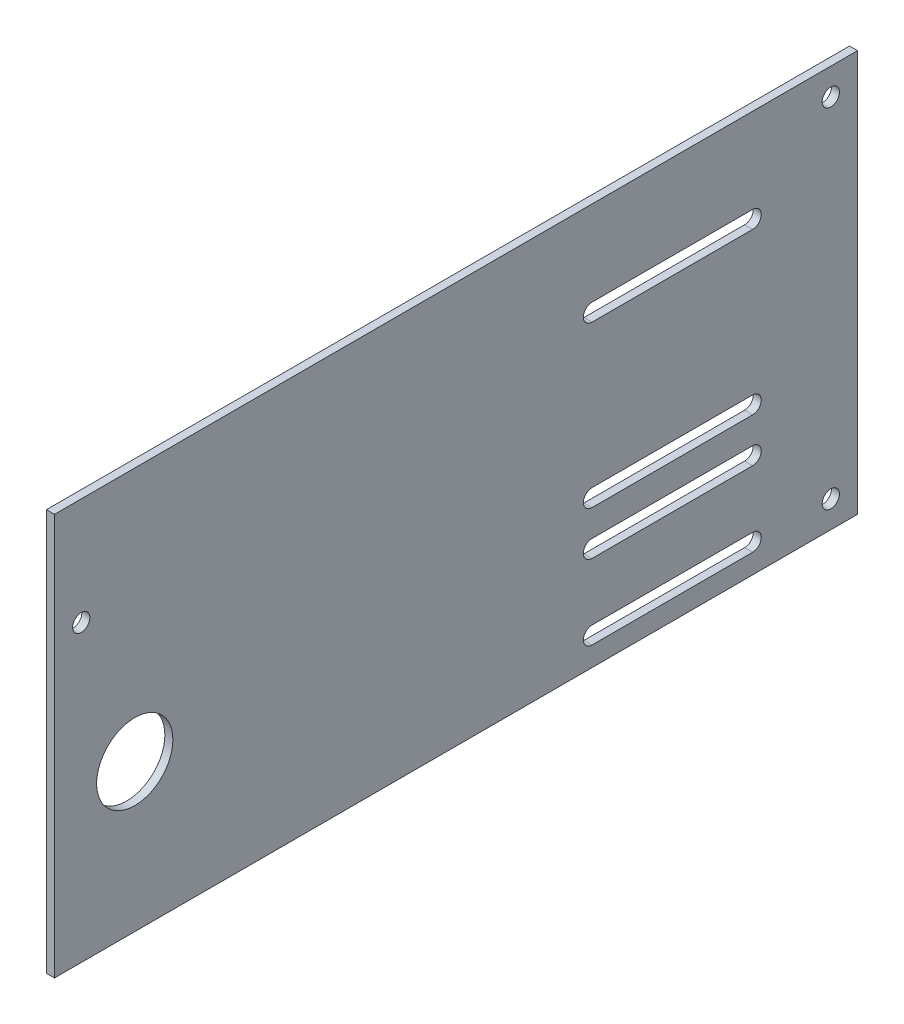
from build123d import *

# Parameters (mm, degrees)
SKETCH1_W           = 300
SKETCH1_H           = 150
SKETCH1_R           = 14.235
BOSS_EXTRUDE1_DEPTH = 3
CUT_EXTRUDE1_REACH  = 337.424
SKETCH2_R           = 3.225


with BuildPart() as part:
    # Sketch1 → Boss-Extrude1 (new body)
    with BuildSketch(Plane(origin=(0, 0, 0), x_dir=(0, 0, -1), z_dir=(1, 0, 0))):
        with Locations((150, 75)):
            Rectangle(SKETCH1_W, SKETCH1_H)
        with Locations((30, 55)):
            Circle(SKETCH1_R, mode=Mode.SUBTRACT)
    extrude(amount=BOSS_EXTRUDE1_DEPTH)

    # Sketch2 → Cut-Extrude1 (cut, up to next)
    with BuildSketch(Plane.ZY, mode=Mode.PRIVATE) as cut_extrude1_sk1:
        with Locations((-290, 140)):
            Circle(SKETCH2_R)
    cut_extrude1_tool1 = extrude(cut_extrude1_sk1.sketch, amount=-CUT_EXTRUDE1_REACH, mode=Mode.PRIVATE) & part.part
    # Sketch2 → Cut-Extrude1 (cut, up to next)
    with BuildSketch(Plane.ZY, mode=Mode.PRIVATE) as cut_extrude1_sk2:
        with Locations((-10, 110)):
            Circle(SKETCH2_R)
    cut_extrude1_tool2 = extrude(cut_extrude1_sk2.sketch, amount=-CUT_EXTRUDE1_REACH, mode=Mode.PRIVATE) & part.part
    # Sketch2 → Cut-Extrude1 (cut, up to next)
    with BuildSketch(Plane.ZY, mode=Mode.PRIVATE) as cut_extrude1_sk3:
        with Locations((-290, 10)):
            Circle(SKETCH2_R)
    cut_extrude1_tool3 = extrude(cut_extrude1_sk3.sketch, amount=-CUT_EXTRUDE1_REACH, mode=Mode.PRIVATE) & part.part
    # Sketch2 → Cut-Extrude1 (cut, up to next)
    with BuildSketch(Plane.ZY, mode=Mode.PRIVATE) as cut_extrude1_sk4:
        with BuildLine():
            Line((-260.8, 58.225), (-200.8, 58.225))
            ThreePointArc((-200.8, 58.225), (-197.575, 55), (-200.8, 51.775))
            Line((-200.8, 51.775), (-260.8, 51.775))
            ThreePointArc((-260.8, 51.775), (-264.025, 55), (-260.8, 58.225))
        make_face()
    cut_extrude1_tool4 = extrude(cut_extrude1_sk4.sketch, amount=-CUT_EXTRUDE1_REACH, mode=Mode.PRIVATE) & part.part
    # Sketch2 → Cut-Extrude1 (cut, up to next)
    with BuildSketch(Plane.ZY, mode=Mode.PRIVATE) as cut_extrude1_sk5:
        with BuildLine():
            Line((-200.8, 111.77), (-260.8, 111.77))
            ThreePointArc((-260.8, 111.77), (-264.03, 115), (-260.8, 118.23))
            Line((-260.8, 118.23), (-200.8, 118.23))
            ThreePointArc((-200.8, 118.23), (-197.57, 115), (-200.8, 111.77))
        make_face()
    cut_extrude1_tool5 = extrude(cut_extrude1_sk5.sketch, amount=-CUT_EXTRUDE1_REACH, mode=Mode.PRIVATE) & part.part
    # Sketch2 → Cut-Extrude1 (cut, up to next)
    with BuildSketch(Plane.ZY, mode=Mode.PRIVATE) as cut_extrude1_sk6:
        with BuildLine():
            Line((-260.8, 41.775), (-200.8, 41.775))
            ThreePointArc((-200.8, 41.775), (-197.575, 38.55), (-200.8, 35.325))
            Line((-200.8, 35.325), (-260.8, 35.325))
            ThreePointArc((-260.8, 35.325), (-264.025, 38.55), (-260.8, 41.775))
        make_face()
    cut_extrude1_tool6 = extrude(cut_extrude1_sk6.sketch, amount=-CUT_EXTRUDE1_REACH, mode=Mode.PRIVATE) & part.part
    # Sketch2 → Cut-Extrude1 (cut, up to next)
    with BuildSketch(Plane.ZY, mode=Mode.PRIVATE) as cut_extrude1_sk7:
        with BuildLine():
            Line((-260.8, 13.775), (-200.8, 13.775))
            ThreePointArc((-200.8, 13.775), (-197.575, 10.55), (-200.8, 7.325))
            Line((-200.8, 7.325), (-260.8, 7.325))
            ThreePointArc((-260.8, 7.325), (-264.025, 10.55), (-260.8, 13.775))
        make_face()
    cut_extrude1_tool7 = extrude(cut_extrude1_sk7.sketch, amount=-CUT_EXTRUDE1_REACH, mode=Mode.PRIVATE) & part.part
    add(cut_extrude1_tool1.solids().sort_by_distance((0, 140, -290))[0], mode=Mode.SUBTRACT)
    add(cut_extrude1_tool2.solids().sort_by_distance((0, 110, -10))[0], mode=Mode.SUBTRACT)
    add(cut_extrude1_tool3.solids().sort_by_distance((0, 10, -290))[0], mode=Mode.SUBTRACT)
    add(cut_extrude1_tool4.solids().sort_by_distance((0, 55, -230.8))[0], mode=Mode.SUBTRACT)
    add(cut_extrude1_tool5.solids().sort_by_distance((0, 115, -230.8))[0], mode=Mode.SUBTRACT)
    add(cut_extrude1_tool6.solids().sort_by_distance((0, 38.55, -230.8))[0], mode=Mode.SUBTRACT)
    add(cut_extrude1_tool7.solids().sort_by_distance((0, 10.55, -230.8))[0], mode=Mode.SUBTRACT)


solid = part.part
